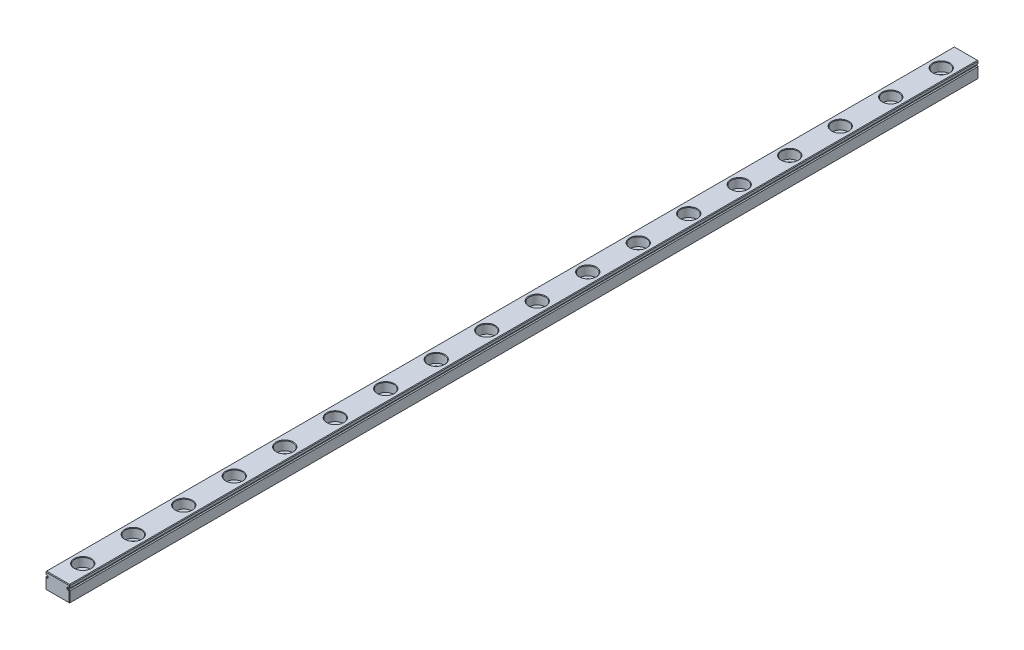
from build123d import *

# Parameters (mm, degrees)
BOSS_EXTRUDE1_DEPTH = 450
CHAMFER1_SIZE       = 0.3
LPATTERN1_COUNT     = 18
LPATTERN1_PITCH     = 25


with BuildPart() as part:
    # Sketch1 → Boss-Extrude1 (new body)
    with BuildSketch(Plane.XY):
        with BuildLine():
            Line((0, 8), (12, 8))
            Line((12, 8), (12, 6.75))
            Line((12, 6.75), (12, 6.559016994))
            ThreePointArc((12, 6.559016994), (11.706107374, 6.475528258), (11.5, 6.25))
            Line((11.5, 6.25), (11, 6.25))
            Line((11, 6.25), (11, 5.75))
            Line((11, 5.75), (11.5, 5.75))
            ThreePointArc((11.5, 5.75), (11.706107374, 5.524471742), (12, 5.440983006))
            Line((12, 5.440983006), (12, 5.25))
            Line((12, 5.25), (12, 0))
            Line((12, 0), (0, 0))
            Line((0, 0), (0, 5.25))
            Line((0, 5.25), (0, 5.440983006))
            ThreePointArc((0, 5.440983006), (0.293892626, 5.524471742), (0.5, 5.75))
            Line((0.5, 5.75), (1, 5.75))
            Line((1, 5.75), (1, 6.25))
            Line((1, 6.25), (0.5, 6.25))
            ThreePointArc((0.5, 6.25), (0.293892626, 6.475528258), (0, 6.559016994))
            Line((0, 6.559016994), (0, 6.75))
            Line((0, 6.75), (0, 8))
        make_face()
    extrude(amount=BOSS_EXTRUDE1_DEPTH)

    # Chamfer1
    chamfer1_edges = [part.edges().sort_by_distance(p)[0] for p in [
        (0, 0, 225),
        (12, 0, 225),
        (0, 8, 225),
        (12, 8, 225),
        (0.293892626, 5.524471742, 450),
        (0.75, 5.75, 450),
        (1, 6, 450),
        (0.75, 6.25, 450),
        (0.293892626, 6.475528258, 450),
        (0, 7.279508497, 450),
        (6, 8, 450),
        (12, 7.279508497, 450),
        (11.706107374, 6.475528258, 450),
        (11.25, 6.25, 450),
        (11, 6, 450),
        (11.25, 5.75, 450),
        (11.706107374, 5.524471742, 450),
        (12, 2.720491503, 450),
        (6, 0, 450),
        (0, 2.720491503, 450),
        (12, 2.720491503, 0),
        (11.706107374, 5.524471742, 0),
        (11.25, 5.75, 0),
        (11, 6, 0),
        (11.25, 6.25, 0),
        (11.706107374, 6.475528258, 0),
        (12, 7.279508497, 0),
        (6, 0, 0),
        (0, 2.720491503, 0),
        (0.293892626, 5.524471742, 0),
        (0.75, 5.75, 0),
        (1, 6, 0),
        (0.75, 6.25, 0),
        (0.293892626, 6.475528258, 0),
        (0, 7.279508497, 0),
        (6, 8, 0),
    ]]
    chamfer(chamfer1_edges, length=CHAMFER1_SIZE)

    # Sketch3 → CBORE for M5 Hex Head Bolt1 (revolve, cut)
    with BuildSketch(Plane(origin=(6, 8, 12.5), x_dir=(0, 0, 1), z_dir=(1, 0, 0))):
        Polygon((0, 0), (0, 8), (2.5, 8), (2.25, 7.75), (2.25, 4.5), (4, 4.5), (4, 0.25), (4.25, 0), align=None)
    cbore_for_m5_hex_head_bolt1 = revolve(axis=Axis((6, 14.35, 12.5), (0, -1, 0)), mode=Mode.SUBTRACT)

    # LPattern1: CBORE for M5 Hex Head Bolt1 ×18
    with Locations(*[(0, 0, i * LPATTERN1_PITCH) for i in range(1, LPATTERN1_COUNT)]):
        add(cbore_for_m5_hex_head_bolt1, mode=Mode.SUBTRACT)


solid = part.part
